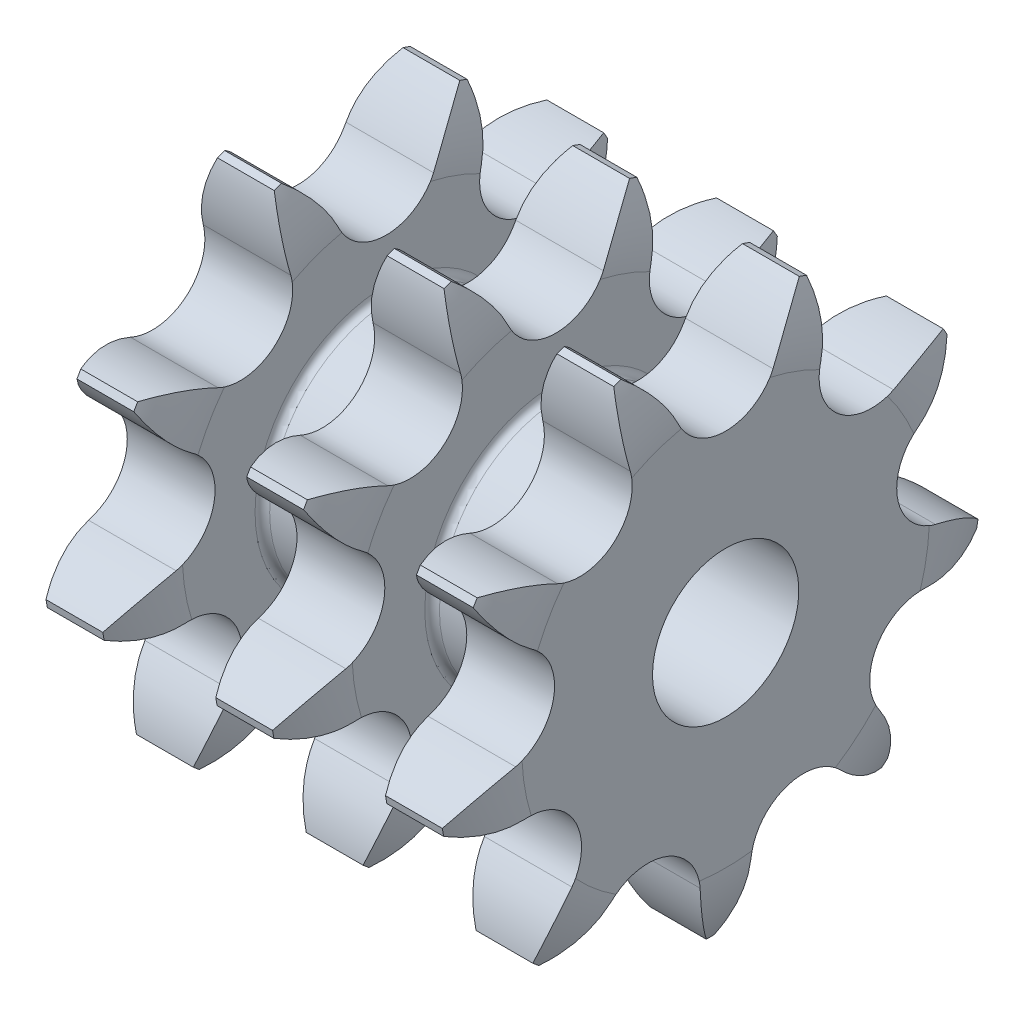
from build123d import *

# Parameters (mm, degrees)
GROOVES_COUNT   = 2
GROOVES_PITCH   = 13.92
TOOTHCUT_DEPTH  = 48.093600013
TEETHCUTS_COUNT = 9
TEETHCUTS_ANGLE = 320
BORSKE_R        = 6
BORE_DEPTH      = 37.2405


with BuildPart() as part:
    # BasProSke → Base-Revolve (revolve)
    with BuildSketch(Plane(origin=(0, 0, 0), x_dir=(1, 0, 0), z_dir=(0, 1, 0))):
        with BuildLine():
            Line((0, 0), (0, 16.712856303))
            ThreePointArc((0, 16.712856303), (0.321571182, 19.552662635), (1.27, 22.248657961))
            Line((1.27, 22.248657961), (33.77, 22.248657961))
            ThreePointArc((33.77, 22.248657961), (34.718428818, 19.552662635), (35.04, 16.712856303))
            Line((35.04, 16.712856303), (35.04, 0))
            Line((35.04, 0), (0, 0))
        make_face()
    revolve(axis=Axis((-10, 0, 0), (1, 0, 0)))

    # GrvSke → Groove (revolve, cut)
    with BuildSketch(Plane(origin=(0, 0, 0), x_dir=(1, 0, 0), z_dir=(0, 1, 0))):
        with BuildLine():
            Line((7.2, 16.712856303), (7.2, 10.751481635))
            ThreePointArc((7.2, 10.751481635), (7.375735931, 10.327217566), (7.8, 10.151481635))
            Line((7.8, 10.151481635), (13.32, 10.151481635))
            ThreePointArc((13.32, 10.151481635), (13.744264069, 10.327217566), (13.92, 10.751481635))
            Line((13.92, 10.751481635), (13.92, 16.712856303))
            ThreePointArc((13.92, 16.712856303), (14.241571182, 19.552662635), (15.19, 22.248657961))
            Line((15.19, 22.248657961), (5.93, 22.248657961))
            ThreePointArc((5.93, 22.248657961), (6.878428818, 19.552662635), (7.2, 16.712856303))
        make_face()
    groove = revolve(axis=Axis((0, 0, 0), (1, 0, 0)), mode=Mode.SUBTRACT)

    # Grooves: Groove ×2
    with Locations(*[(i * GROOVES_PITCH, 0, 0) for i in range(1, GROOVES_COUNT)]):
        add(groove, mode=Mode.SUBTRACT)

    # TooCutSke → ToothCut (cut, through all)
    with BuildSketch(Plane(origin=(0, 0, 0), x_dir=(0, 0, -1), z_dir=(1, 0, 0))):
        with BuildLine():
            ThreePointArc((3.89490303, 16.792484851), (5.53909395, 19.346647696), (7.807509589, 21.366895728))
            ThreePointArc((7.807509589, 21.366895728), (0, 22.748657961), (-7.807509589, 21.366895728))
            ThreePointArc((-7.807509589, 21.366895728), (-5.53909395, 19.346647696), (-3.89490303, 16.792484851))
            ThreePointArc((-3.89490303, 16.792484851), (0, 14.311157961), (3.89490303, 16.792484851))
        make_face()
    toothcut = extrude(amount=TOOTHCUT_DEPTH, mode=Mode.SUBTRACT)

    # TeethCuts: ToothCut ×9 about axis
    teethcuts_axis = Axis((-10, 0, 0), (1, 0, 0))
    for i in range(1, TEETHCUTS_COUNT):
        add(toothcut.rotate(teethcuts_axis, i * TEETHCUTS_ANGLE / (TEETHCUTS_COUNT - 1)), mode=Mode.SUBTRACT)

    # BorSke → Bore (cut, symmetric)
    with BuildSketch(Plane(origin=(0, 0, 0), x_dir=(0, 0, -1), z_dir=(1, 0, 0))):
        Circle(BORSKE_R)
    extrude(amount=BORE_DEPTH, both=True, mode=Mode.SUBTRACT)


solid = part.part
